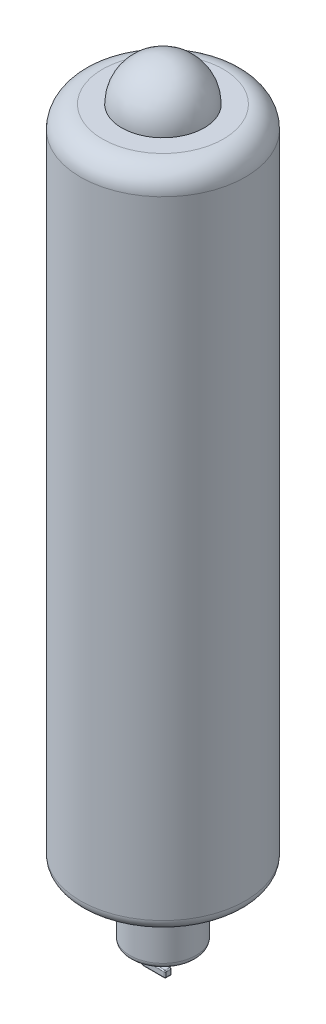
from build123d import *

# Parameters (mm, degrees)
SKETCH1_R           = 7.5
BOSS_EXTRUDE1_DEPTH = 60
SKETCH2_R           = 3.75
BOSS_EXTRUDE2_DEPTH = 3.75
FILLET1_R           = 3.75
FILLET2_R           = 2
FILLET3_R           = 1
SKETCH3_R           = 3
BOSS_EXTRUDE3_DEPTH = 6.05
FILLET4_R           = 0.5
SKETCH4_W           = 0.5
SKETCH4_H           = 1.15
BOSS_EXTRUDE4_DEPTH = 0.3
FILLET5_R           = 0.1
FILLET6_R           = 0.06


with BuildPart() as part:
    # Sketch1 → Boss-Extrude1 (new body)
    with BuildSketch(Plane(origin=(0, 0, 0), x_dir=(1, 0, 0), z_dir=(0, 1, 0))):
        with Locations(Location((0, 0, 0), (0, 0, 270))):
            Circle(SKETCH1_R)
    extrude(amount=BOSS_EXTRUDE1_DEPTH)

    # Sketch2 → Boss-Extrude2 (add)
    with BuildSketch(Plane(origin=(0, 60, 0), x_dir=(1, 0, 0), z_dir=(0, 1, 0))):
        with Locations(Location((0, 0, 0), (0, 0, 270))):
            Circle(SKETCH2_R)
    extrude(amount=BOSS_EXTRUDE2_DEPTH)

    # Fillet1
    fillet1_edges = [part.edges().sort_by_distance(p)[0] for p in [
        (0, 63.75, -3.75),
    ]]
    fillet(fillet1_edges, radius=FILLET1_R - 0.0001)  # a hair under: the kernel refuses the full size

    # Fillet2
    fillet2_edges = [part.edges().sort_by_distance(p)[0] for p in [
        (0, 60, -7.5),
    ]]
    fillet(fillet2_edges, radius=FILLET2_R)

    # Fillet3
    fillet3_edges = [part.edges().sort_by_distance(p)[0] for p in [
        (0, 0, -7.5),
    ]]
    fillet(fillet3_edges, radius=FILLET3_R)

    # Sketch3 → Boss-Extrude3 (add)
    with BuildSketch(Plane.XZ):
        with Locations(Location((0, 0, 0), (0, 0, 90))):
            Circle(SKETCH3_R)
    extrude(amount=BOSS_EXTRUDE3_DEPTH)

    # Fillet4
    fillet4_edges = [part.edges().sort_by_distance(p)[0] for p in [
        (0, -6.05, -3),
    ]]
    fillet(fillet4_edges, radius=FILLET4_R)

    # Sketch4 → Boss-Extrude4 (add, symmetric)
    with BuildSketch(Plane.XY):
        with Locations((0.25, -6.625)):
            Rectangle(SKETCH4_W, SKETCH4_H)
        with BuildLine():
            Line((0.5, -8.5), (-1.4, -8.5))
            ThreePointArc((-1.4, -8.5), (-1.824264069, -8.324264069), (-2, -7.9))
            Line((-2, -7.9), (-2, -6.05))
            Line((-2, -6.05), (-1.4, -6.05))
            Line((-1.4, -6.05), (-1.4, -7.5))
            ThreePointArc((-1.4, -7.5), (-1.282842712, -7.782842712), (-1, -7.9))
            Line((-1, -7.9), (0.5, -7.9))
            Line((0.5, -7.9), (0.5, -8.5))
        make_face()
    extrude(amount=BOSS_EXTRUDE4_DEPTH, both=True)

    # Fillet5
    fillet5_edges = [part.edges().sort_by_distance(p)[0] for p in [
        (0, -6.625, -0.3),
        (0.25, -7.2, -0.3),
        (0, -7.2, 0),
        (0.5, -6.625, -0.3),
        (0.5, -7.2, 0),
        (0, -6.625, 0.3),
        (0.25, -7.2, 0.3),
        (0.5, -6.625, 0.3),
        (-1.824264069, -8.324264069, -0.3),
        (-0.45, -8.5, -0.3),
        (0.5, -8.2, -0.3),
        (0.5, -8.5, 0),
        (-0.25, -7.9, -0.3),
        (0.5, -7.9, 0),
        (-1.282842712, -7.782842712, -0.3),
        (-1.4, -6.775, -0.3),
        (-2, -6.975, -0.3),
        (-1.824264069, -8.324264069, 0.3),
        (-0.45, -8.5, 0.3),
        (0.5, -8.2, 0.3),
        (-0.25, -7.9, 0.3),
        (-1.282842712, -7.782842712, 0.3),
        (-1.4, -6.775, 0.3),
        (-2, -6.975, 0.3),
    ]]
    fillet(fillet5_edges, radius=FILLET5_R)

    # Fillet6
    fillet6_edges = [part.edges().sort_by_distance(p)[0] for p in [
        (-1.7, -6.05, 0.3),
        (-2, -6.05, 0),
        (-1.7, -6.05, -0.3),
        (0, -6.05, 0),
        (0.25, -6.05, 0.3),
        (0.5, -6.05, 0),
        (0.25, -6.05, -0.3),
        (-1.4, -6.05, 0),
        (-1.970710678, -6.05, 0.270710678),
        (-1.970710678, -6.05, -0.270710678),
        (0.029289322, -6.05, -0.270710678),
        (0.029289322, -6.05, 0.270710678),
        (0.470710678, -6.05, -0.270710678),
        (0.470710678, -6.05, 0.270710678),
        (-1.429289322, -6.05, -0.270710678),
        (-1.429289322, -6.05, 0.270710678),
    ]]
    fillet(fillet6_edges, radius=FILLET6_R)


solid = part.part
